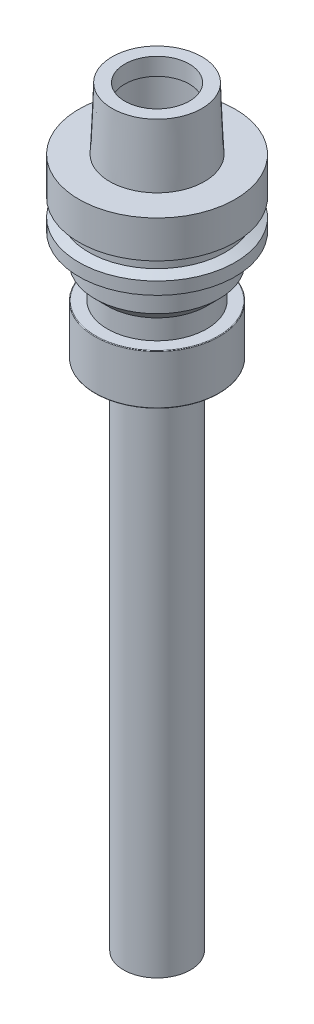
from build123d import *

# Parameters (mm, degrees)
SWEEP1_START       = -204.68052275
SWEEP1_OUTLINE_R   = 13.5
SWEEP1_OUTLINE_R_2 = 2.5
SWEEP1_DEPTH       = 204.68052275


# Read off the part's stored shape, not the designer's step: Sweep1
with BuildPart() as part:
    # Sketch1 → Revolve1 (revolve)
    with BuildSketch(Plane.XY, mode=Mode.PRIVATE) as revolve1_sk:
        with BuildLine():
            Line((-13, 98.3), (-18.085, 98.3))
            Line((-18.085, 98.3), (-19.1, 73.3))
            Line((-19.1, 73.3), (-31.5, 73.3))
            Line((-31.5, 73.3), (-31.5, 58.3))
            Line((-31.5, 58.3), (-27.5, 56.8))
            Line((-27.5, 56.8), (-27.5, 52.8))
            Line((-27.5, 52.8), (-31.5, 51.3))
            Line((-31.5, 51.3), (-31.5, 46.3))
            Line((-31.5, 46.3), (-25, 46.3))
            Line((-25, 46.3), (-25, 35.3))
            Line((-25, 35.3), (-20, 30.3))
            Line((-20, 30.3), (-20, 22.3))
            Line((-20, 22.3), (-24.75, 22.3))
            ThreePointArc((-24.75, 22.3), (-24.926776695, 22.226776695), (-25, 22.05))
            Line((-25, 22.05), (-25, 2.444337567))
            ThreePointArc((-25, 2.444337567), (-24.966506351, 2.319337567), (-24.875, 2.227831216))
            Line((-24.875, 2.227831216), (-20.669872981, -0.2))
            Line((-20.669872981, -0.2), (-13.5, -0.2))
            Line((-13.5, -0.2), (-13.5, 0))
            Line((-13.5, 0), (-2.5, 0))
            Line((-2.5, 0), (-2.5, 15))
            Line((-2.5, 15), (0, 15))
            Line((0, 15), (0, 64.3))
            Line((0, 64.3), (-13, 64.3))
            Line((-13, 64.3), (-13, 69.3))
            Line((-13, 69.3), (-14, 69.3))
            ThreePointArc((-14, 69.3), (-15.414213562, 69.885786438), (-16, 71.3))
            Line((-16, 71.3), (-16, 89.3))
            ThreePointArc((-16, 89.3), (-15.414213562, 90.714213562), (-14, 91.3))
            Line((-14, 91.3), (-13, 91.3))
            Line((-13, 91.3), (-13, 98.3))
        make_face()
    revolve(revolve1_sk.sketch.rotate(Axis((0, 0, 0), (0, 1, 0)), 270), axis=Axis((0, 0, 0), (0, 1, 0)))

    # Sweep1 outline → Sweep1 (add)
    with BuildSketch(Plane(origin=(0, 0, 0), x_dir=(1, 0, 0), z_dir=(0, 1, 0)).offset(SWEEP1_START)):
        Circle(SWEEP1_OUTLINE_R)
        Circle(SWEEP1_OUTLINE_R_2, mode=Mode.SUBTRACT)
    extrude(amount=SWEEP1_DEPTH)


solid = part.part
